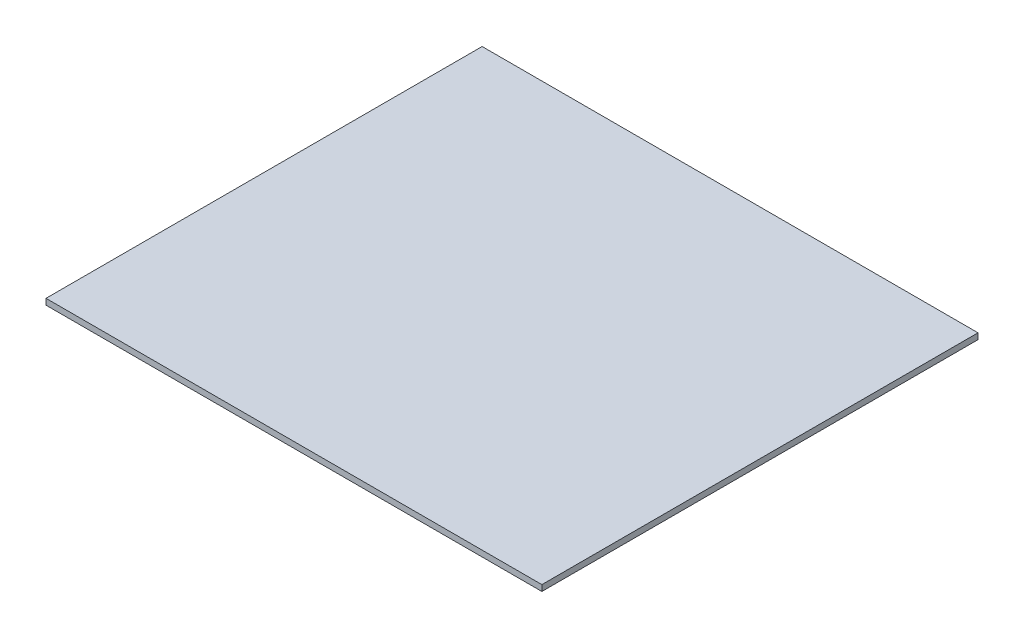
from build123d import *

# Parameters (mm, degrees)
SKETCH1_W           = 210.82
SKETCH1_H           = 185.42
BOSS_EXTRUDE1_DEPTH = 2.54


with BuildPart() as part:
    # Sketch1 → Boss-Extrude1 (new body)
    with BuildSketch(Plane(origin=(0, 0, 0), x_dir=(1, 0, 0), z_dir=(0, 1, 0))):
        with Locations((-105.41, 6.295123457)):
            Rectangle(SKETCH1_W, SKETCH1_H)
    extrude(amount=BOSS_EXTRUDE1_DEPTH)


solid = part.part
